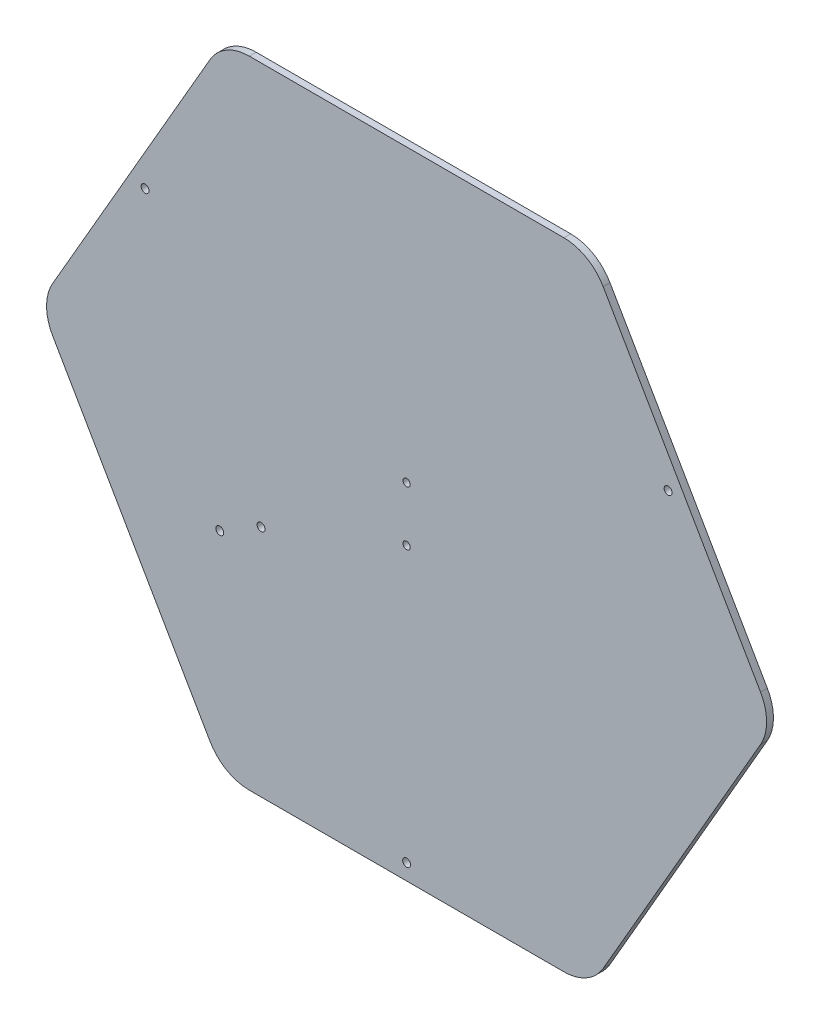
from build123d import *

# Parameters (mm, degrees)
SALIENTE_EXTRUIR1_DEPTH = 3
REDONDEO1_R             = 20
CROQUIS2_R              = 1.75
CORTAR_EXTRUIR1_DEPTH   = 212.545651301
CROQUIS3_R              = 1.75
CORTAR_EXTRUIR2_DEPTH   = 225.144562915
CROQUIS4_R              = 1.6
CORTAR_EXTRUIR3_DEPTH   = 225.144562915


with BuildPart() as part:
    # Croquis1 → Saliente-Extruir1 (new body)
    with BuildSketch(Plane.XY):
        Polygon((-80.829037687, -140), (80.829037687, -140), (161.658075373, 0), (80.829037687, 140), (-80.829037687, 140), (-161.658075373, 0), align=None)
    extrude(amount=SALIENTE_EXTRUIR1_DEPTH)

    # Redondeo1
    redondeo1_edges = [part.edges().sort_by_distance(p)[0] for p in [
        (80.829037687, 140, 1.5),
        (-80.829037687, 140, 1.5),
        (-161.658075373, 0, 1.5),
        (-80.829037687, -140, 1.5),
        (80.829037687, -140, 1.5),
        (161.658075373, 0, 1.5),
    ]]
    fillet(redondeo1_edges, radius=REDONDEO1_R)

    # Croquis2 → Cortar-Extruir1 (cut, through all)
    with BuildSketch(Plane(origin=(0, 0, 0), x_dir=(1, 0, 0), z_dir=(0, 0, -1))):
        with Locations((0, 133)):
            Circle(CROQUIS2_R)
        with Locations((115.181378703, -66.5)):
            Circle(CROQUIS2_R)
        with Locations((-115.181378703, -66.5)):
            Circle(CROQUIS2_R)
    extrude(amount=-CORTAR_EXTRUIR1_DEPTH, mode=Mode.SUBTRACT)

    # Croquis3 → Cortar-Extruir2 (cut, through all)
    with BuildSketch(Plane.XY.offset(74.15)):
        with Locations((-64.09392774, -37.004646434)):
            Circle(CROQUIS3_R)
        with Locations((-82.280461219, -47.504646434)):
            Circle(CROQUIS3_R)
    extrude(amount=-CORTAR_EXTRUIR2_DEPTH, mode=Mode.SUBTRACT)

    # Croquis4 → Cortar-Extruir3 (cut, through all)
    with BuildSketch(Plane.XY.offset(74.15)):
        with Locations((0, 12)):
            Circle(CROQUIS4_R)
        with Locations((0, -12)):
            Circle(CROQUIS4_R)
    extrude(amount=-CORTAR_EXTRUIR3_DEPTH, mode=Mode.SUBTRACT)


solid = part.part
